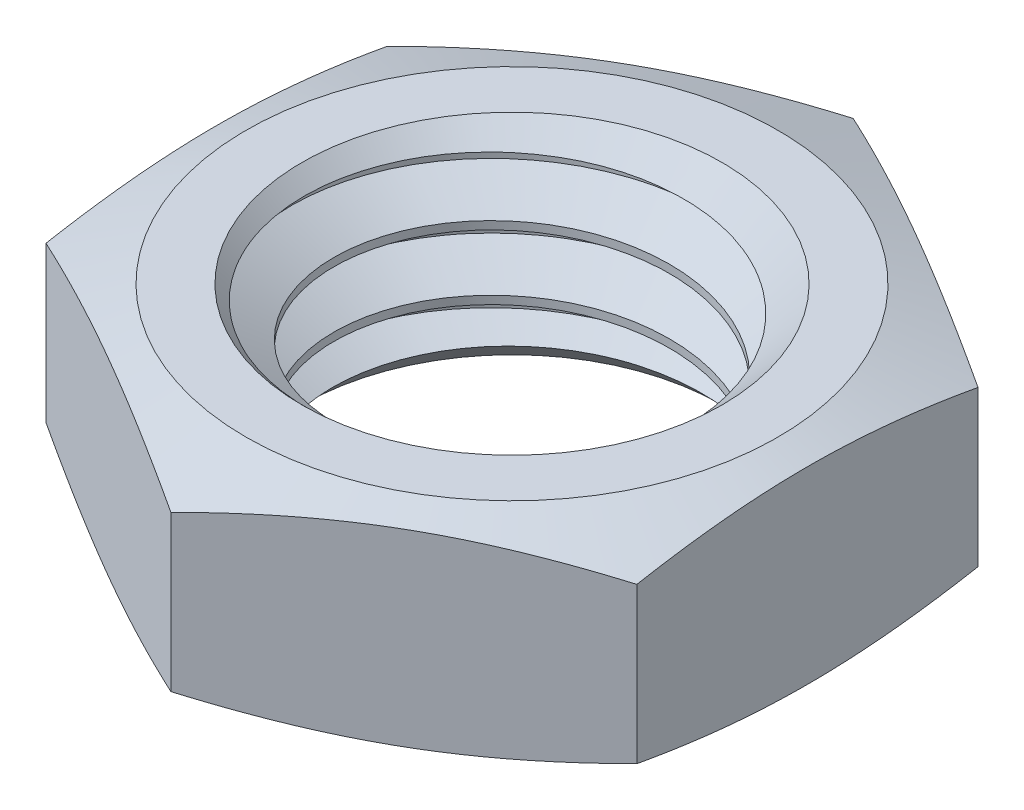
from build123d import *

# Parameters (mm, degrees)
BOSS_EXTRUDE3_DEPTH      = 3.175
BOSS_EXTRUDE3_DEPTH_BACK = 3.175
SKETCH8_R                = 6.35
SWEEP1_PITCH             = 1.953846154
CUT_EXTRUDE2_DEPTH       = 16.071830435
CUT_EXTRUDE2_DEPTH_BACK  = 16.071830435
SKETCH12_W               = 16.0734375
SKETCH12_H               = 254


# Read off the part's stored shape, not the designer's step: Cut-Extrude1
with BuildPart() as part:
    # Sketch8 → Boss-Extrude3 (new, two sides: drawn at the far end of the back side and taken through both)
    with BuildSketch(Plane(origin=(0, 0, 0), x_dir=(1, 0, 0), z_dir=(0, 1, 0)).offset(-BOSS_EXTRUDE3_DEPTH_BACK)):
        Polygon((0, -10.311114964), (8.9296875, -5.155557482), (8.9296875, 5.155557482), (0, 10.311114964), (-8.9296875, 5.155557482), (-8.9296875, -5.155557482), align=None)
        with Locations(Location((0, 0, 0), (0, 0, 270))):
            Circle(SKETCH8_R, mode=Mode.SUBTRACT)
    extrude(amount=BOSS_EXTRUDE3_DEPTH + BOSS_EXTRUDE3_DEPTH_BACK)

    # Sketch10 → Cut-Revolve1 (revolve, cut)
    with BuildSketch(Plane(origin=(0, 0, 0), x_dir=(0, 0, -1), z_dir=(1, 0, 0))):
        Polygon((-10.311114964, 2.347187477), (-8.03671875, 3.175), (-10.311114964, 3.175), align=None)
        Polygon((-10.311114964, -2.347187477), (-10.311114964, -3.175), (-8.03671875, -3.175), align=None)
    revolve(axis=Axis((0, 3.175, 0), (0, -1, 0)), mode=Mode.SUBTRACT)

    # Sweep1: the profile of Sketch11 screwed along a right-hand helix of 4.875 turns, 10 arcs to a turn; built about Z, then put on its axis
    sweep1_z = Axis((0, 0, 0), (0, 0, 1))
    sweep1_corners = [(5.080939697, 0, -0.732692308), (5.080939697, 0, -0.976923077), (6.455755025, 0, -1.770673077), (6.455755025, 0, 0.061057692)]
    with BuildLine(mode=Mode.PRIVATE) as sweep1_profile:
        Line(sweep1_corners[0], sweep1_corners[1])
        Line(sweep1_corners[1], sweep1_corners[2])
        Line(sweep1_corners[2], sweep1_corners[3])
        Line(sweep1_corners[3], sweep1_corners[0])
    sweep1_cap = Face(sweep1_profile.wire())
    sweep1_turn_angles = [0, 18, 36, 54, 72, 90, 108, 126, 144, 162, 180, 198, 216, 234, 252, 270, 288, 306, 324, 342, 360]
    sweep1_turn_weights = [1, 0.9510565162951535, 1, 0.9510565162951535, 1, 0.9510565162951535, 1, 0.9510565162951535, 1, 0.9510565162951535, 1, 0.9510565162951535, 1, 0.9510565162951535, 1, 0.9510565162951535, 1, 0.9510565162951535, 1, 0.9510565162951535, 1]
    sweep1_turn_rails = [Edge.make_bspline([Vector(p[0], p[1], 0).rotate(sweep1_z, sweep1_turn_angles[k]) / sweep1_turn_weights[k] + Vector(0, 0, p[2] + SWEEP1_PITCH * sweep1_turn_angles[k] / 360) for k in range(21)], [0, 0, 0, 1, 1, 2, 2, 3, 3, 4, 4, 5, 5, 6, 6, 7, 7, 8, 8, 9, 9, 10, 10, 10], 2, sweep1_turn_weights) for p in sweep1_corners]
    sweep1_turn_sides = [Face.make_surface_from_curves(sweep1_turn_rails[p[0]], sweep1_turn_rails[p[1]]) for p in [(0, 1), (1, 2), (2, 3), (3, 0)]]
    sweep1_last_angles = [1440, 1458, 1476, 1494, 1512, 1530, 1548, 1566, 1584, 1602, 1620, 1638, 1656, 1674, 1692, 1710, 1728, 1741.5, 1755]
    sweep1_last_weights = [1, 0.9510565162951535, 1, 0.9510565162951535, 1, 0.9510565162951535, 1, 0.9510565162951535, 1, 0.9510565162951535, 1, 0.9510565162951535, 1, 0.9510565162951535, 1, 0.9510565162951535, 1, 0.9723699203976706, 1]
    sweep1_last_rails = [Edge.make_bspline([Vector(p[0], p[1], 0).rotate(sweep1_z, sweep1_last_angles[k]) / sweep1_last_weights[k] + Vector(0, 0, p[2] + SWEEP1_PITCH * sweep1_last_angles[k] / 360) for k in range(19)], [0, 0, 0, 1, 1, 2, 2, 3, 3, 4, 4, 5, 5, 6, 6, 7, 7, 8, 8, 9, 9, 9], 2, sweep1_last_weights) for p in sweep1_corners]
    sweep1_last_sides = [Face.make_surface_from_curves(sweep1_last_rails[p[0]], sweep1_last_rails[p[1]]) for p in [(0, 1), (1, 2), (2, 3), (3, 0)]]
    sweep1 = Plane(origin=(0, -3.175, 0), x_dir=(0, 0, 1), z_dir=(0, 1, 0)) * Solid(Shell([*[p.moved(Location((0, 0, SWEEP1_PITCH * i))) for i in range(4) for p in sweep1_turn_sides], *sweep1_last_sides, sweep1_cap, sweep1_cap.rotate(sweep1_z, 1755).moved(Location((0, 0, SWEEP1_PITCH * 1755 / 360)))]))
    add(sweep1)

    # Sketch12 → Cut-Extrude2 (cut, two sides: drawn at the far end of the back side and taken through both)
    with BuildSketch(Plane(origin=(0, 0, 0), x_dir=(0, 0, -1), z_dir=(1, 0, 0)).offset(-CUT_EXTRUDE2_DEPTH_BACK)):
        with Locations((0, 130.175)):
            Rectangle(SKETCH12_W, SKETCH12_H)
        with Locations((0, -130.175)):
            Rectangle(SKETCH12_W, SKETCH12_H)
    extrude(amount=CUT_EXTRUDE2_DEPTH + CUT_EXTRUDE2_DEPTH_BACK, mode=Mode.SUBTRACT)

    # Cut-Extrude1 outline → Cut-Extrude1 (revolve, cut)
    with BuildSketch(Plane.XY):
        Polygon((6.35, -3.175), (5.080937725, -1.905937725), (5.080937725, -3.175), align=None)
    cut_extrude1 = revolve(axis=Axis((0, 0, 0), (0, 1, 0)), mode=Mode.SUBTRACT)

    # Mirror1: Cut-Extrude1 across plane
    add(cut_extrude1.mirror(Plane.ZX), mode=Mode.SUBTRACT)


solid = part.part
